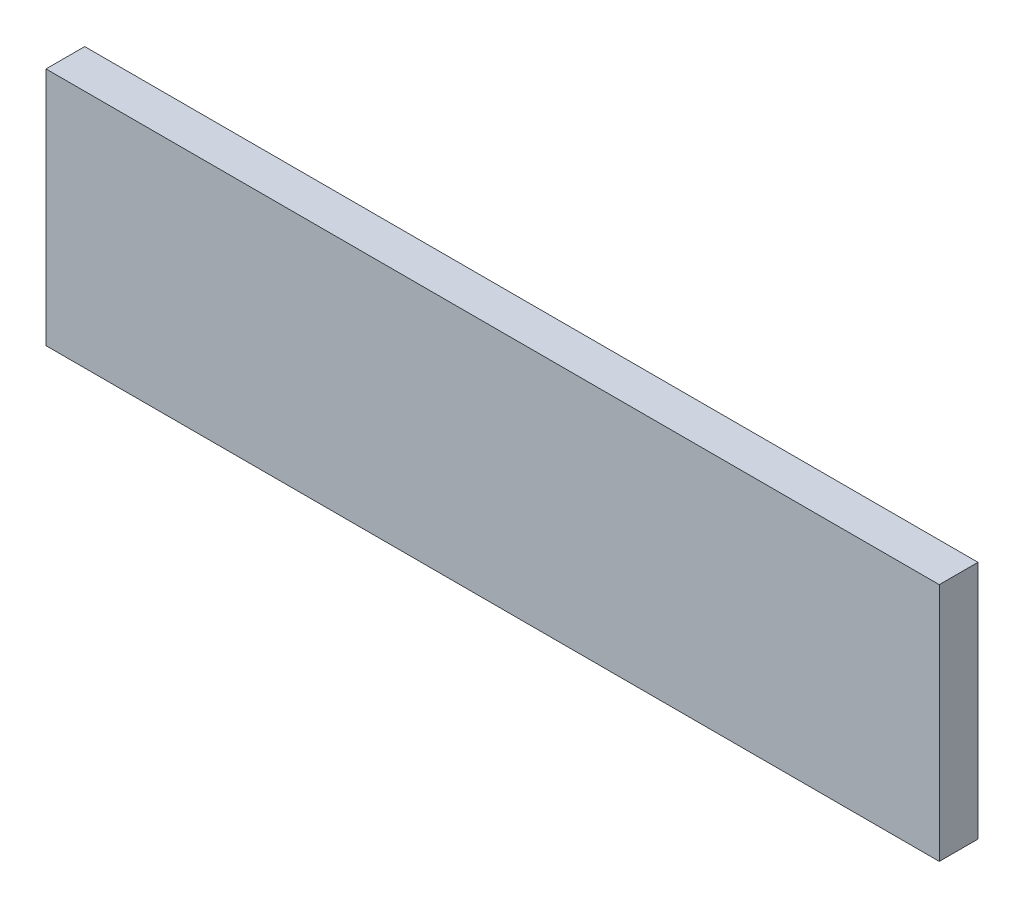
from build123d import *

# Parameters (mm, degrees)
ESQUISSE1_W        = 150
ESQUISSE1_H        = 40.25
BOSS_EXTRU_1_DEPTH = 6.5


with BuildPart() as part:
    # Esquisse1 → Boss.-Extru.1 (new body)
    with BuildSketch(Plane.XY):
        with Locations((38.833729247, 2.207802548)):
            Rectangle(ESQUISSE1_W, ESQUISSE1_H)
    extrude(amount=BOSS_EXTRU_1_DEPTH)


solid = part.part
